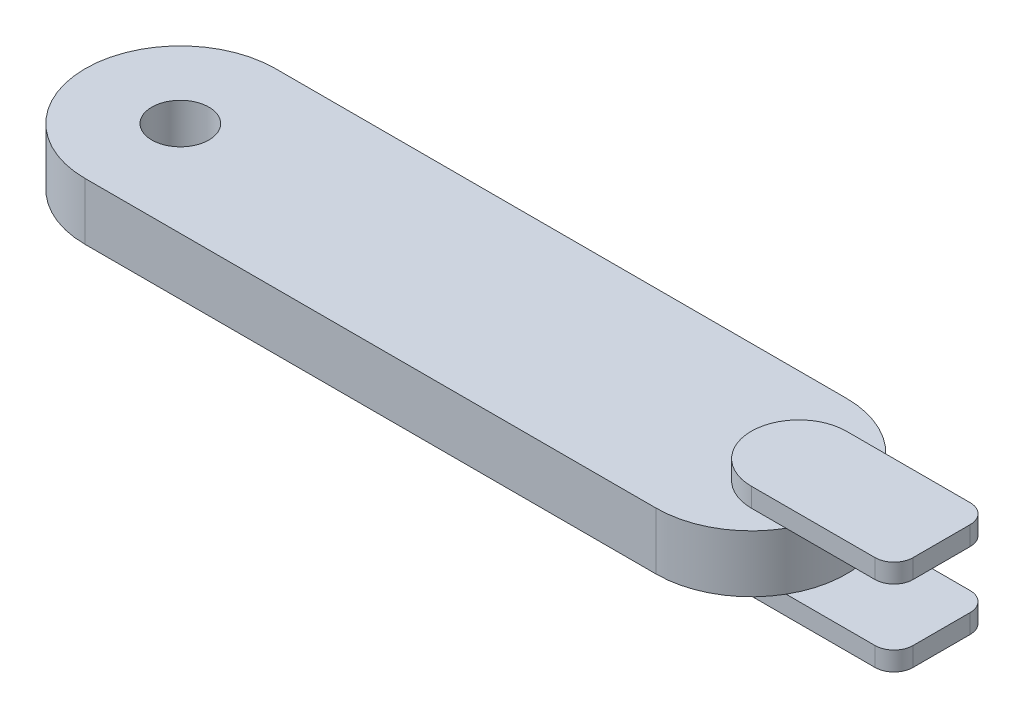
from build123d import *

# Parameters (mm, degrees)
BOSS_EXTRUDE1_DEPTH = 3
SKETCH5_W           = 10
SKETCH5_H           = 1
BOSS_EXTRUDE2_DEPTH = 2.5
FILLET1_R           = 2.5
FILLET2_R           = 1
SKETCH6_R           = 1.5
CUT_EXTRUDE1_DEPTH  = 41.509258201


with BuildPart() as part:
    # Sketch2 → Boss-Extrude1 (new body)
    with BuildSketch(Plane(origin=(0, 0, 0), x_dir=(1, 0, 0), z_dir=(0, 1, 0))):
        with BuildLine():
            Line((0, 5), (30, 5))
            ThreePointArc((30, 5), (35, 0), (30, -5))
            Line((30, -5), (0, -5))
            ThreePointArc((0, -5), (-5, 0), (0, 5))
        make_face()
    extrude(amount=BOSS_EXTRUDE1_DEPTH)

    # Sketch5 → Boss-Extrude2 (add, symmetric)
    with BuildSketch(Plane.XY):
        with Locations((35, 3.5)):
            Rectangle(SKETCH5_W, SKETCH5_H)
        with Locations((35, -0.5)):
            Rectangle(SKETCH5_W, SKETCH5_H)
    extrude(amount=BOSS_EXTRUDE2_DEPTH, both=True)

    # Fillet1
    fillet1_edges = [part.edges().sort_by_distance(p)[0] for p in [
        (30, -0.5, 2.5),
        (30, -0.5, -2.5),
        (30, 3.5, -2.5),
        (30, 3.5, 2.5),
    ]]
    fillet(fillet1_edges, radius=FILLET1_R - 0.0001)  # a hair under: the kernel refuses the full size

    # Fillet2
    fillet2_edges = [part.edges().sort_by_distance(p)[0] for p in [
        (40, 3.5, -2.5),
        (40, 3.5, 2.5),
        (40, -0.5, -2.5),
        (40, -0.5, 2.5),
    ]]
    fillet(fillet2_edges, radius=FILLET2_R)

    # Sketch6 → Cut-Extrude1 (cut, through all)
    with BuildSketch(Plane(origin=(0, 3, 0), x_dir=(1, 0, 0), z_dir=(0, 1, 0))):
        with Locations(Location((0, 0, 0), (0, 0, 270))):
            Circle(SKETCH6_R)
    extrude(amount=-CUT_EXTRUDE1_DEPTH, mode=Mode.SUBTRACT)


solid = part.part
